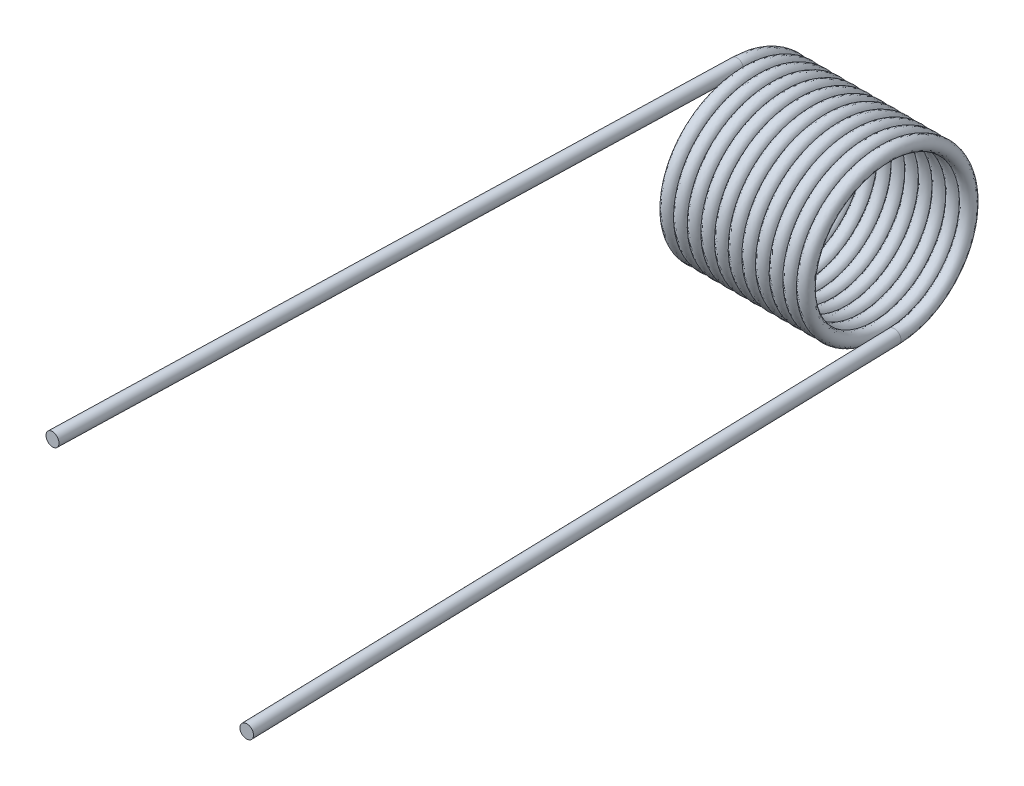
from build123d import *

# Parameters (mm, degrees)
SWEEP1_PITCH   = 1.0414
SKETCH3_R      = 0.508
EXTRUDE1_DEPTH = 50.8
SKETCH4_R      = 0.508
EXTRUDE2_DEPTH = 50.8


with BuildPart() as part:
    # Sweep1: the profile of Sketch2 screwed along a left-hand helix of 11.5 turns, 6 arcs to a turn; built about Z, then put on its axis
    sweep1_z = Axis((0, 0, 0), (0, 0, 1))
    sweep1_corners = [(6.264789653, 0.010971013, 0.393421966), (5.550025094, 0.008953254, 0.321064842), (5.622410347, -0.010971013, -0.393421966), (6.337174906, -0.008953254, -0.321064842)]
    with BuildLine(mode=Mode.PRIVATE) as sweep1_profile:
        ThreePointArc((6.264789653, 0.010971013, 0.393421966), (5.892415897, 0.014088584, 0.505218467), (5.550025094, 0.008953254, 0.321064842))
        ThreePointArc((5.550025094, 0.008953254, 0.321064842), (5.438185133, -0.001426772, -0.051164213), (5.622410347, -0.010971013, -0.393421966))
        ThreePointArc((5.622410347, -0.010971013, -0.393421966), (5.994784103, -0.014088584, -0.505218467), (6.337174906, -0.008953254, -0.321064842))
        ThreePointArc((6.337174906, -0.008953254, -0.321064842), (6.449014867, 0.001426772, 0.051164213), (6.264789653, 0.010971013, 0.393421966))
    sweep1_cap = Face(sweep1_profile.wire())
    sweep1_arcs = [((6.264789653, 0.010971013, 0.393421966), (5.871214747, 0.019924267, 0.714486808), (5.550025094, 0.008953254, 0.321064842), (1, 0.7071067811865476, 1)), ((5.550025094, 0.008953254, 0.321064842), (5.228835441, -0.00201776, -0.072357124), (5.622410347, -0.010971013, -0.393421966), (1, 0.7071067811865476, 1)), ((5.622410347, -0.010971013, -0.393421966), (6.015985253, -0.019924267, -0.714486808), (6.337174906, -0.008953254, -0.321064842), (1, 0.7071067811865476, 1)), ((6.337174906, -0.008953254, -0.321064842), (6.658364559, 0.00201776, 0.072357124), (6.264789653, 0.010971013, 0.393421966), (1, 0.7071067811865476, 1))]  # start, shoulder, end, weights
    sweep1_turn_angles = [0, -30, -60, -90, -120, -150, -180, -210, -240, -270, -300, -330, -360]
    sweep1_turn_weights = [1, 0.8660254037844387, 1, 0.8660254037844387, 1, 0.8660254037844387, 1, 0.8660254037844387, 1, 0.8660254037844387, 1, 0.8660254037844387, 1]
    sweep1_turn_sides = [Face.make_bezier_surface([[Vector(p[j][0], p[j][1], 0).rotate(sweep1_z, sweep1_turn_angles[2 * i + k]) / sweep1_turn_weights[2 * i + k] + Vector(0, 0, p[j][2] + -SWEEP1_PITCH * sweep1_turn_angles[2 * i + k] / 360) for k in range(3)] for j in range(3)], [[p[3][j] * sweep1_turn_weights[2 * i + k] for k in range(3)] for j in range(3)]) for p in sweep1_arcs for i in range(6)]
    sweep1_last_angles = [-3960, -3990, -4020, -4050, -4080, -4110, -4140]
    sweep1_last_weights = [1, 0.8660254037844387, 1, 0.8660254037844387, 1, 0.8660254037843712, 1]
    sweep1_last_sides = [Face.make_bezier_surface([[Vector(p[j][0], p[j][1], 0).rotate(sweep1_z, sweep1_last_angles[2 * i + k]) / sweep1_last_weights[2 * i + k] + Vector(0, 0, p[j][2] + -SWEEP1_PITCH * sweep1_last_angles[2 * i + k] / 360) for k in range(3)] for j in range(3)], [[p[3][j] * sweep1_last_weights[2 * i + k] for k in range(3)] for j in range(3)]) for p in sweep1_arcs for i in range(3)]
    sweep1 = Plane(origin=(0, 0, 0), x_dir=(0, 1, 0), z_dir=(1, 0, 0)) * Solid(Shell([*[p.moved(Location((0, 0, SWEEP1_PITCH * i))) for i in range(11) for p in sweep1_turn_sides], *sweep1_last_sides, sweep1_cap, sweep1_cap.rotate(sweep1_z, -4140).moved(Location((0, 0, -SWEEP1_PITCH * -4140 / 360)))]))
    add(sweep1)

    # Sketch3 → Extrude1 (add)
    with BuildSketch(Plane(origin=(0, 0, 0), x_dir=(-0.7744526892296922, -0.6322630972036725, -0.02159648256816618), z_dir=(-0.027875286203178775, -3.3601593729670746e-15, 0.9996114087079493))):
        with Locations(Location((-3.757918945, -4.604826399, 0), (0, 0, 320.782712195))):
            Circle(SKETCH3_R)
    extrude(amount=EXTRUDE1_DEPTH)

    # Sketch4 → Extrude2 (add)
    with BuildSketch(Plane(origin=(0.009305808, 0, 0.333707489), x_dir=(0.8175734388362561, -0.5753728181346228, -0.022798953074225917), z_dir=(0.027875286203178765, 1.4653035729228484e-13, 0.9996114087079493))):
        with Locations(Location((13.211127143, 2.026826214, 0), (0, 0, 215.125745058))):
            Circle(SKETCH4_R)
    extrude(amount=EXTRUDE2_DEPTH)


solid = part.part
